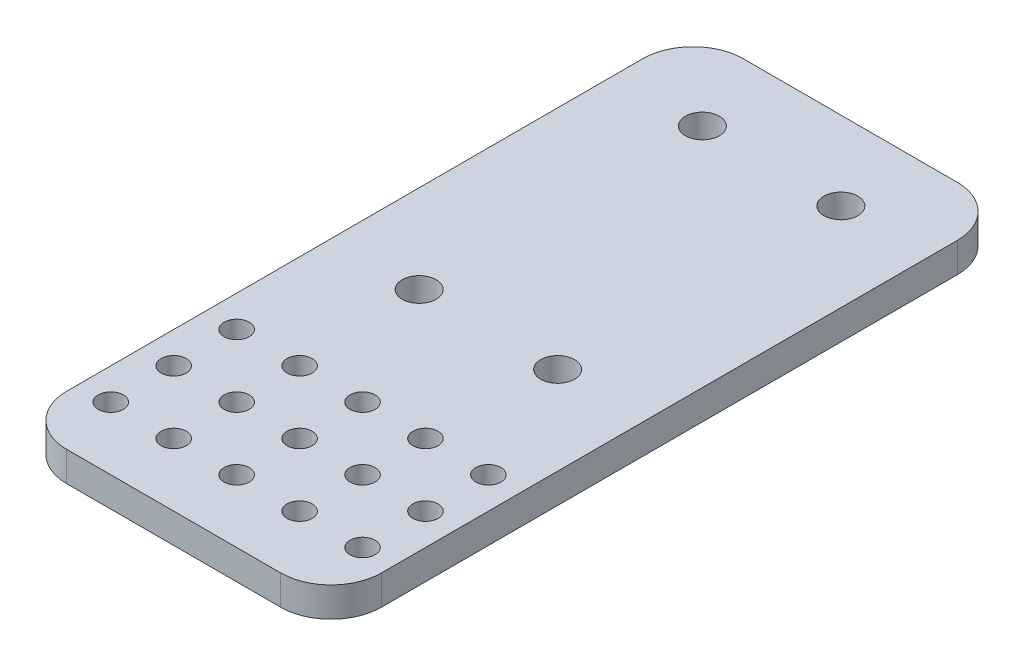
from build123d import *

# Parameters (mm, degrees)
SKETCH1_W           = 63.5
SKETCH1_H           = 136.525
SKETCH1_R           = 2.54
BOSS_EXTRUDE1_DEPTH = 6
FILLET1_R           = 10.16
SKETCH6_R           = 3.429
CUT_EXTRUDE2_DEPTH  = 151.689500713


with BuildPart() as part:
    # Sketch1 → Boss-Extrude1 (new body)
    with BuildSketch(Plane(origin=(0, 0, 0), x_dir=(1, 0, 0), z_dir=(0, 1, 0))):
        with Locations((31.75, 68.2625)):
            Rectangle(SKETCH1_W, SKETCH1_H)
        with Locations((6.35, 12.7)):
            Circle(SKETCH1_R, mode=Mode.SUBTRACT)
        with Locations((6.35, 25.4)):
            Circle(SKETCH1_R, mode=Mode.SUBTRACT)
        with Locations((19.05, 12.7)):
            Circle(SKETCH1_R, mode=Mode.SUBTRACT)
        with Locations((31.75, 12.7)):
            Circle(SKETCH1_R, mode=Mode.SUBTRACT)
        with Locations((19.05, 25.4)):
            Circle(SKETCH1_R, mode=Mode.SUBTRACT)
        with Locations((31.75, 25.4)):
            Circle(SKETCH1_R, mode=Mode.SUBTRACT)
        with Locations((6.35, 38.1)):
            Circle(SKETCH1_R, mode=Mode.SUBTRACT)
        with Locations((19.05, 38.1)):
            Circle(SKETCH1_R, mode=Mode.SUBTRACT)
        with Locations((31.75, 38.1)):
            Circle(SKETCH1_R, mode=Mode.SUBTRACT)
        with Locations((44.45, 12.7)):
            Circle(SKETCH1_R, mode=Mode.SUBTRACT)
        with Locations((44.45, 25.4)):
            Circle(SKETCH1_R, mode=Mode.SUBTRACT)
        with Locations((57.15, 12.7)):
            Circle(SKETCH1_R, mode=Mode.SUBTRACT)
        with Locations((57.15, 25.4)):
            Circle(SKETCH1_R, mode=Mode.SUBTRACT)
        with Locations((44.45, 38.1)):
            Circle(SKETCH1_R, mode=Mode.SUBTRACT)
        with Locations((57.15, 38.1)):
            Circle(SKETCH1_R, mode=Mode.SUBTRACT)
    extrude(amount=BOSS_EXTRUDE1_DEPTH)

    # Fillet1
    fillet1_edges = [part.edges().sort_by_distance(p)[0] for p in [
        (0, 3, -136.525),
        (63.5, 3, -136.525),
        (63.5, 3, 0),
        (0, 3, 0),
    ]]
    fillet(fillet1_edges, radius=FILLET1_R)

    # Sketch6 → Cut-Extrude2 (cut, through all)
    with BuildSketch(Plane(origin=(0, 6, 0), x_dir=(1, 0, 0), z_dir=(0, 1, 0))):
        with Locations((17.78, 120.65)):
            Circle(SKETCH6_R)
        with Locations((45.72, 120.65)):
            Circle(SKETCH6_R)
        with Locations((17.78, 63.5)):
            Circle(SKETCH6_R)
        with Locations((45.72, 63.5)):
            Circle(SKETCH6_R)
    extrude(amount=-CUT_EXTRUDE2_DEPTH, mode=Mode.SUBTRACT)


solid = part.part
